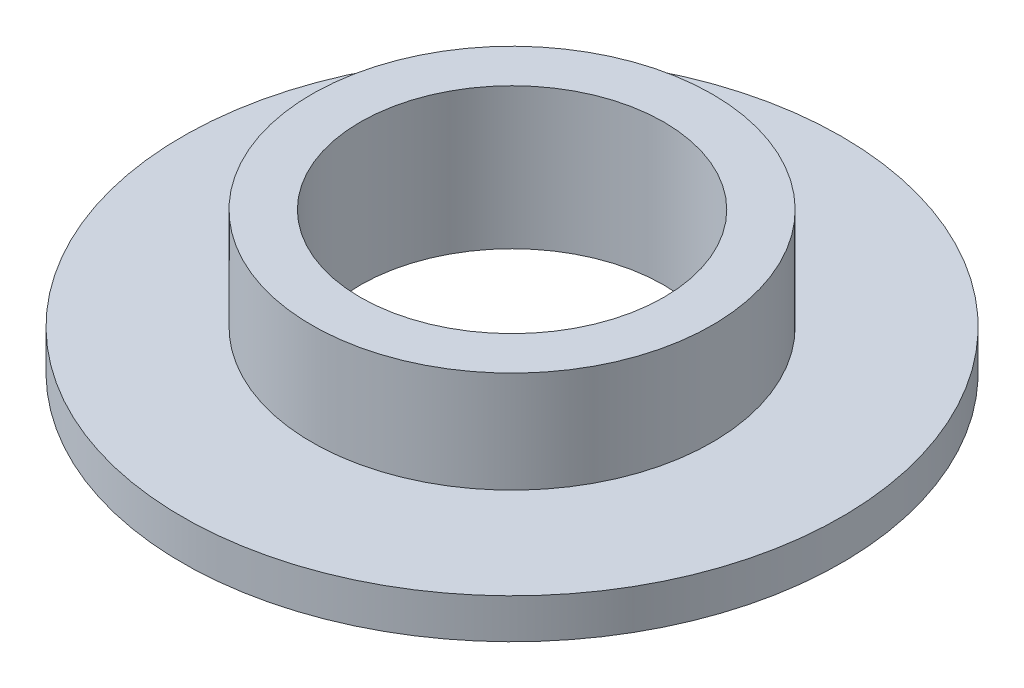
from build123d import *


with BuildPart() as part:
    # Sketch2 → Revolve1 (revolve)
    with BuildSketch(Plane(origin=(0, 0, 0), x_dir=(0, 0, -1), z_dir=(1, 0, 0))):
        Polygon((4.1656, 0), (9.0424, 0), (9.0424, 1.0922), (5.49275, 1.0922), (5.49275, 3.8735), (4.1656, 3.8735), align=None)
    revolve(axis=Axis((0, -1000, 0), (0, 1, 0)))


solid = part.part
